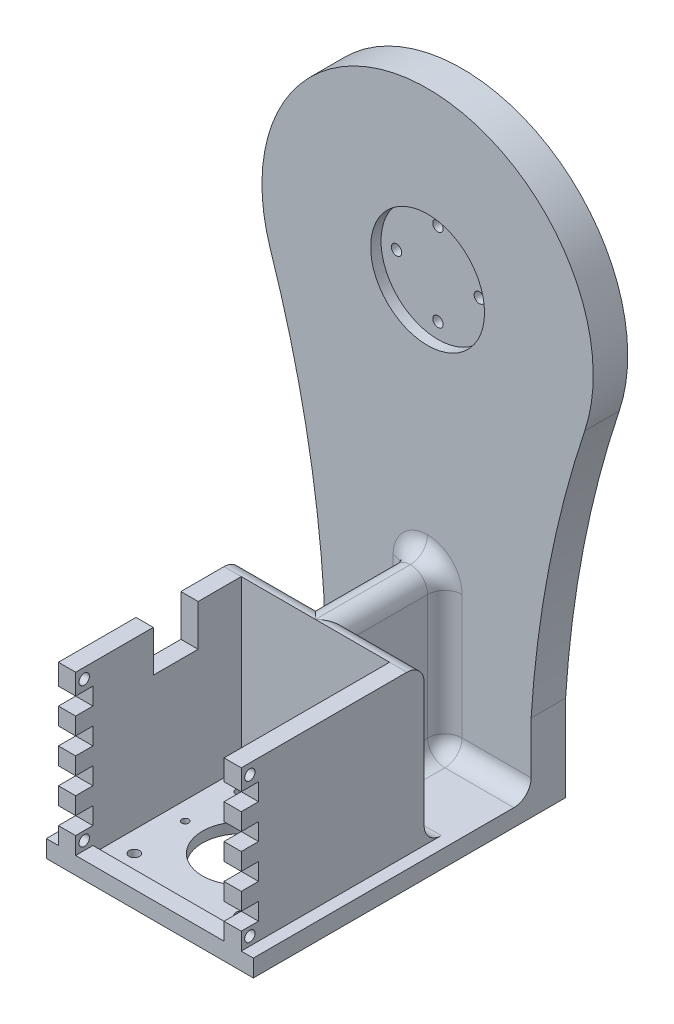
from build123d import *

# Parameters (mm, degrees)
SALIENTE_EXTRUIR1_DEPTH = 10
CROQUIS5_R              = 16.5
CORTAR_EXTRUIR4_DEPTH   = 3
CROQUIS4_R              = 1.5
CORTAR_EXTRUIR8_DEPTH   = 126.015998976
CROQUIS6_W              = 60
CROQUIS6_H              = 90.5
SALIENTE_EXTRUIR2_DEPTH = 5
CROQUIS7_R              = 11.25
CROQUIS7_R_2            = 1.5
CORTAR_EXTRUIR9_DEPTH   = 10
SALIENTE_EXTRUIR3_DEPTH = 46
CROQUIS10_W             = 5
CROQUIS10_H             = 5
CORTAR_EXTRUIR11_DEPTH  = 5
CROQUIS11_R             = 1.5
CORTAR_EXTRUIR12_DEPTH  = 168.751304019
CROQUIS13_W             = 43
CROQUIS13_H             = 43
CORTAR_EXTRUIR13_DEPTH  = 2
CROQUIS16_R             = 1
CORTAR_EXTRUIR14_DEPTH  = 10
NERVIO1_REACH           = 159.779
CROQUIS17_WALL_W        = 345.058235512
CROQUIS17_WALL_H        = 10
REDONDEO2_R             = 5
CROQUIS18_W             = 13
CROQUIS18_H             = 12
CORTAR_EXTRUIR15_DEPTH  = 10


with BuildPart() as part:
    # Croquis1 → Saliente-Extruir1 (new body)
    with BuildSketch(Plane.XY):
        with BuildLine():
            Line((-30, -95), (-30, -115))
            Line((-30, -115), (30, -115))
            Line((30, -115), (30, -95))
            ThreePointArc((30, -95), (35.193890367, -54.576427951), (45.544194453, -15.156726282))
            ThreePointArc((45.544194453, -15.156726282), (0, 48), (-45.544194453, -15.156726282))
            ThreePointArc((-45.544194453, -15.156726282), (-35.193890367, -54.576427951), (-30, -95))
        make_face()
    extrude(amount=SALIENTE_EXTRUIR1_DEPTH)

    # Croquis5 → Cortar-Extruir4 (cut)
    with BuildSketch(Plane.XY.offset(10)):
        Circle(CROQUIS5_R)
    extrude(amount=-CORTAR_EXTRUIR4_DEPTH, mode=Mode.SUBTRACT)

    # Croquis4 → Cortar-Extruir8 (cut, through all)
    with BuildSketch(Plane(origin=(0, 0, 10), x_dir=(-1, 0, 0), z_dir=(0, 0, 1))):
        with Locations(Location((0, 12, 0), (0, 0, 180))):
            Circle(CROQUIS4_R)
        with Locations(Location((12, 0, 0), (0, 0, 180))):
            Circle(CROQUIS4_R)
        with Locations(Location((0, -12, 0), (0, 0, 180))):
            Circle(CROQUIS4_R)
        with Locations(Location((-12, 0, 0), (0, 0, 180))):
            Circle(CROQUIS4_R)
    extrude(amount=-CORTAR_EXTRUIR8_DEPTH, mode=Mode.SUBTRACT)

    # Croquis6 → Saliente-Extruir2 (add)
    with BuildSketch(Plane.XZ.offset(115)):
        with Locations((0, 45.25)):
            Rectangle(CROQUIS6_W, CROQUIS6_H)
    extrude(amount=SALIENTE_EXTRUIR2_DEPTH)

    # Croquis7 → Cortar-Extruir9 (cut)
    with BuildSketch(Plane.XZ.offset(120)):
        with Locations(Location((0, 64, 0), (0, 0, 270))):
            Circle(CROQUIS7_R)
        with Locations(Location((-15.5, 79.5, 0), (0, 0, 270))):
            Circle(CROQUIS7_R_2)
        with Locations(Location((15.5, 79.5, 0), (0, 0, 270))):
            Circle(CROQUIS7_R_2)
        with Locations(Location((15.5, 48.5, 0), (0, 0, 270))):
            Circle(CROQUIS7_R_2)
        with Locations(Location((-15.5, 48.5, 0), (0, 0, 270))):
            Circle(CROQUIS7_R_2)
    extrude(amount=-CORTAR_EXTRUIR9_DEPTH, mode=Mode.SUBTRACT)

    # Croquis8 → Saliente-Extruir3 (add)
    with BuildSketch(Plane(origin=(0, -115, 0), x_dir=(1, 0, 0), z_dir=(0, 1, 0))):
        Polygon((-21.5, -42.5), (21.5, -42.5), (21.5, -90.5), (26.5, -90.5), (26.5, -37.5), (-26.5, -37.5), (-26.5, -90.5), (-21.5, -90.5), align=None)
    extrude(amount=SALIENTE_EXTRUIR3_DEPTH)

    # Croquis10 → Cortar-Extruir11 (cut)
    with BuildSketch(Plane.XY.offset(90.5)):
        with Locations((24, -107.5)):
            Rectangle(CROQUIS10_W, CROQUIS10_H)
        with Locations((-24, -107.5)):
            Rectangle(CROQUIS10_W, CROQUIS10_H)
        with Locations((-24, -97.5)):
            Rectangle(CROQUIS10_W, CROQUIS10_H)
        with Locations((24, -97.5)):
            Rectangle(CROQUIS10_W, CROQUIS10_H)
        with Locations((-24, -87.5)):
            Rectangle(CROQUIS10_W, CROQUIS10_H)
        with Locations((24, -87.5)):
            Rectangle(CROQUIS10_W, CROQUIS10_H)
        with Locations((-24, -77.5)):
            Rectangle(CROQUIS10_W, CROQUIS10_H)
        with Locations((24, -77.5)):
            Rectangle(CROQUIS10_W, CROQUIS10_H)
    extrude(amount=-CORTAR_EXTRUIR11_DEPTH, mode=Mode.SUBTRACT)

    # Croquis11 → Cortar-Extruir12 (cut, through all)
    with BuildSketch(Plane.ZY.offset(26.5)):
        with Locations((88, -112.5)):
            Circle(CROQUIS11_R)
        with Locations((88, -72)):
            Circle(CROQUIS11_R)
    extrude(amount=-CORTAR_EXTRUIR12_DEPTH, mode=Mode.SUBTRACT)

    # Croquis13 → Cortar-Extruir13 (cut)
    with BuildSketch(Plane(origin=(0, -115, 0), x_dir=(1, 0, 0), z_dir=(0, 1, 0))):
        with Locations((0, -64)):
            Rectangle(CROQUIS13_W, CROQUIS13_H)
    extrude(amount=-CORTAR_EXTRUIR13_DEPTH, mode=Mode.SUBTRACT)

    # Croquis16 → Cortar-Extruir14 (cut)
    with BuildSketch(Plane.XZ.offset(120)):
        with Locations(Location((-16.25, 64, 0), (0, 0, 270))):
            Circle(CROQUIS16_R)
        with Locations(Location((16.25, 64, 0), (0, 0, 270))):
            Circle(CROQUIS16_R)
        with Locations(Location((-23, 64, 0), (0, 0, 270))):
            Circle(CROQUIS16_R)
        with Locations(Location((23, 64, 0), (0, 0, 270))):
            Circle(CROQUIS16_R)
    extrude(amount=-CORTAR_EXTRUIR14_DEPTH, mode=Mode.SUBTRACT)

    # Croquis17 wall → Nervio1 (add, up to next)
    with BuildSketch(Plane(origin=(0, -69, 23.75), x_dir=(0, 0, -1), z_dir=(0, 1, 0)), mode=Mode.PRIVATE) as nervio1_sk1:
        Rectangle(CROQUIS17_WALL_W, CROQUIS17_WALL_H)
    nervio1_tool1 = extrude(nervio1_sk1.sketch, amount=-NERVIO1_REACH, mode=Mode.PRIVATE) - part.part
    add(nervio1_tool1.solids().sort_by_distance((0, -69, 23.75))[0])

    # Redondeo2
    redondeo2_edges = [part.edges().sort_by_distance(p)[0] for p in [
        (15.75, -115, 37.5),
        (15.75, -69, 37.5),
        (-17.5, -115, 10),
        (-15.75, -69, 37.5),
        (-15.75, -115, 37.5),
        (17.5, -115, 10),
        (5, -69, 23.75),
        (0, -69, 10),
        (5, -115, 23.75),
        (5, -92, 10),
        (-5, -115, 23.75),
        (-5, -92, 10),
        (-5, -69, 23.75),
    ]]
    fillet(redondeo2_edges, radius=REDONDEO2_R - 0.0001)  # a hair under: the kernel refuses the full size

    # Croquis18 → Cortar-Extruir15 (cut)
    with BuildSketch(Plane.ZY.offset(26.5)):
        with Locations((61.5, -75)):
            Rectangle(CROQUIS18_W, CROQUIS18_H)
    extrude(amount=-CORTAR_EXTRUIR15_DEPTH, mode=Mode.SUBTRACT)


solid = part.part
